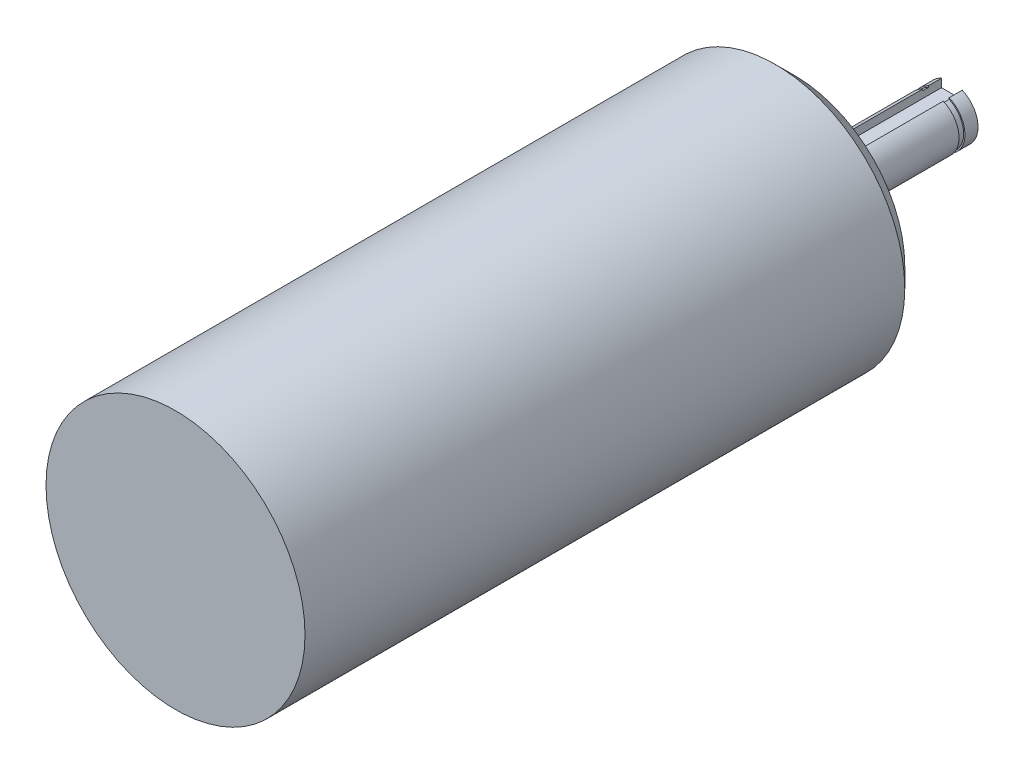
from build123d import *

# Parameters (mm, degrees)
SKETCH1_R                       = 19.8
BOSS_EXTRUDE1_DEPTH             = 94.7
M4X0_7_TAPPED_HOLE1_D           = 3.3
M4X0_7_TAPPED_HOLE1_DEPTH       = 4
M4X0_7_TAPPED_HOLE1_CSINK_D     = 4.05
M4X0_7_TAPPED_HOLE1_CSINK_ANGLE = 90
M4X0_7_TAPPED_HOLE1_TIP         = 0.991420021
SKETCH6_R                       = 4
BOSS_EXTRUDE2_DEPTH             = 24
CHAMFER1_SIZE                   = 3
SKETCH7_W                       = 3.175
SKETCH7_H                       = 3.175
CUT_EXTRUDE1_DEPTH              = 19
CUT_EXTRUDE2_START              = -0.9
SKETCH8_R                       = 4
SKETCH8_R_2                     = 3.8
CUT_EXTRUDE2_DEPTH              = 0.9


with BuildPart() as part:
    # Sketch1 → Boss-Extrude1 (new body)
    with BuildSketch(Plane.XY):
        Circle(SKETCH1_R)
    extrude(amount=BOSS_EXTRUDE1_DEPTH)

    # M4x0.7 Tapped Hole1
    with Locations(Plane(origin=(0, 0, 0), x_dir=(-1, 0, 0), z_dir=(0, 0, -1))):
        with Locations((0, 12.5), (-12.5, 0), (0, -12.5), (12.5, 0)):
            CounterSinkHole(M4X0_7_TAPPED_HOLE1_D / 2, M4X0_7_TAPPED_HOLE1_CSINK_D / 2, depth=M4X0_7_TAPPED_HOLE1_DEPTH, counter_sink_angle=M4X0_7_TAPPED_HOLE1_CSINK_ANGLE)
            with Locations((0, 0, -(M4X0_7_TAPPED_HOLE1_DEPTH + M4X0_7_TAPPED_HOLE1_TIP / 2))):  # 118° drill point
                Cone(0, M4X0_7_TAPPED_HOLE1_D / 2, M4X0_7_TAPPED_HOLE1_TIP, mode=Mode.SUBTRACT)

    # Sketch6 → Boss-Extrude2 (add)
    with BuildSketch(Plane(origin=(0, 0, 0), x_dir=(-1, 0, 0), z_dir=(0, 0, -1))):
        Circle(SKETCH6_R)
    extrude(amount=BOSS_EXTRUDE2_DEPTH)

    # Chamfer1
    chamfer1_edges = [part.edges().sort_by_distance(p)[0] for p in [
        (-19.8, 0, 0),
    ]]
    chamfer(chamfer1_edges, length=CHAMFER1_SIZE)

    # Sketch7 → Cut-Extrude1 (cut)
    with BuildSketch(Plane(origin=(0, 0, -24), x_dir=(-1, 0, 0), z_dir=(0, 0, -1))):
        with Locations((0, 4)):
            Rectangle(SKETCH7_W, SKETCH7_H)
    extrude(amount=-CUT_EXTRUDE1_DEPTH, mode=Mode.SUBTRACT)

    # Sketch8 → Cut-Extrude2 (cut)
    with BuildSketch(Plane(origin=(0, 0, -22), x_dir=(-1, 0, 0), z_dir=(0, 0, -1)).offset(CUT_EXTRUDE2_START)):
        Circle(SKETCH8_R)
        Circle(SKETCH8_R_2, mode=Mode.SUBTRACT)
    extrude(amount=CUT_EXTRUDE2_DEPTH, mode=Mode.SUBTRACT)


solid = part.part
